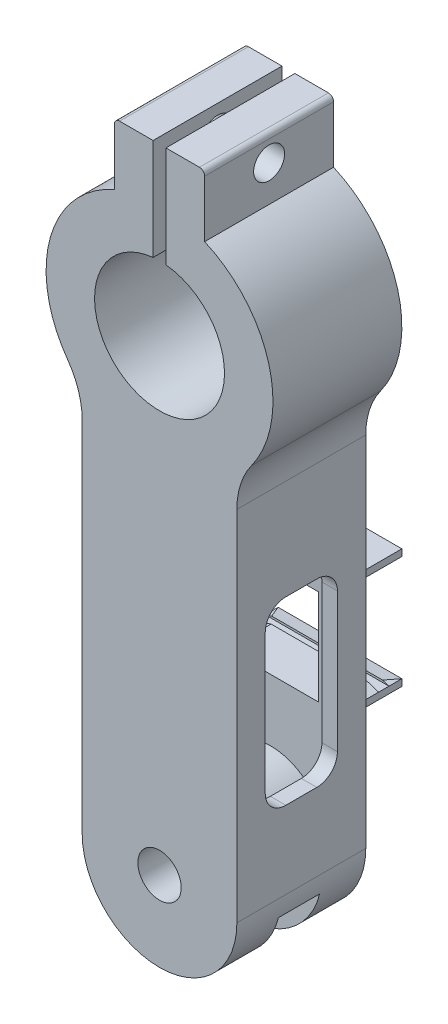
from build123d import *

# Parameters (mm, degrees)
BOSS_EXTRUDE1_DEPTH      = 25
CUT_EXTRUDE4_START       = 8.5
CUT_EXTRUDE4_DEPTH       = 8
SKETCH10_R               = 4.2
CUT_EXTRUDE6_DEPTH       = 122.590026426
SKETCH11_W               = 24
SKETCH11_H               = 24.52
BOSS_EXTRUDE2_DEPTH      = 10
CUT_EXTRUDE7_DEPTH       = 122.590026426
CUT_EXTRUDE8_START       = 5.5
SKETCH14_W               = 24
SKETCH14_H               = 20.52
CUT_EXTRUDE8_DEPTH       = 2
SKETCH22_R               = 12.6
CUT_EXTRUDE16_DEPTH      = 122.590026426
SKETCH24_W               = 17.5
SKETCH24_H               = 12
BOSS_EXTRUDE3_DEPTH      = 25
FILLET6_R                = 15
FILLET7_R                = 1
SKETCH25_R               = 3
CUT_EXTRUDE18_DEPTH      = 25
SKETCH26_W               = 2.5
SKETCH26_H               = 20
CUT_EXTRUDE19_DEPTH      = 25
SHELL14_START            = 9.25
SHELL14_DEPTH            = 1.5
SHELL14_START_2          = 3
SHELL14_2_DEPTH          = 19
SHELL14_3_OUTLINE_R      = 9.2
SHELL14_3_DEPTH          = 0.5
SHELL14_START_3          = 21.5
SHELL14_4_OUTLINE_R      = 9.2
SHELL14_4_DEPTH          = 0.5
SHELL14_START_4          = 8
SHELL14_5_DEPTH          = 2.75
SHELL14_START_5          = 19.25
SHELL14_6_DEPTH          = 1.5
SKETCH27_W               = 17.72
SKETCH27_H               = 18.5
CUT_EXTRUDE20_DEPTH      = 10
SKETCH28_W               = 14
SKETCH28_H               = 35
CUT_EXTRUDE21_DEPTH      = 3
SKETCH29_W               = 14
SKETCH29_H               = 35
CUT_EXTRUDE22_DEPTH      = 3
FILLET8_R                = 4
FILLET9_R                = 4
FILLET10_R               = 1
CUT_EXTRUDE23_DEPTH      = 132.116752851
CUT_EXTRUDE23_DEPTH_BACK = 132.116752851
SKETCH32_W               = 24
SKETCH32_H               = 0.7
CUT_EXTRUDE24_DEPTH      = 132.116752851
FILLET11_R               = 3
BOSS_EXTRUDE4_REACH      = 133.117
SKETCH33_W               = 28
SKETCH33_H               = 2


with BuildPart() as part:
    # Sketch1 → Boss-Extrude1 (new body)
    with BuildSketch(Plane.XY):
        with BuildLine():
            Line((30, 0), (30, 75))
            ThreePointArc((30, 75), (15, 113.093476939), (0, 75))
            Line((0, 75), (0, 0))
            ThreePointArc((0, 0), (15, -15), (30, 0))
        make_face()
    extrude(amount=BOSS_EXTRUDE1_DEPTH)

    # Sketch9 → Cut-Extrude4 (cut)
    with BuildSketch(Plane.XY.offset(CUT_EXTRUDE4_START)):
        with BuildLine():
            Line((7.015640289, 0), (0, -3.844579475))
            Line((0, -3.844579475), (0, -19.136394538))
            Line((0, -19.136394538), (30, -19.136394538))
            Line((30, -19.136394538), (30, -3.844579475))
            Line((30, -3.844579475), (22.984359711, 0))
            ThreePointArc((22.984359711, 0), (15, 8.5), (7.015640289, 0))
        make_face()
    extrude(amount=CUT_EXTRUDE4_DEPTH, mode=Mode.SUBTRACT)

    # Sketch10 → Cut-Extrude6 (cut, through all)
    with BuildSketch(Plane.XY):
        with Locations(Location((15, 0.5, 0), (0, 0, 180))):
            Circle(SKETCH10_R)
    extrude(amount=CUT_EXTRUDE6_DEPTH, mode=Mode.SUBTRACT)

    # Sketch11 → Boss-Extrude2 (add)
    with BuildSketch(Plane(origin=(0, 0, 0), x_dir=(-1, 0, 0), z_dir=(0, 0, -1))):
        with Locations((-15, 32.26)):
            Rectangle(SKETCH11_W, SKETCH11_H)
    extrude(amount=BOSS_EXTRUDE2_DEPTH)

    # Sketch12 → Cut-Extrude7 (cut, through all)
    with BuildSketch(Plane(origin=(0, 0, 0), x_dir=(-1, 0, 0), z_dir=(0, 0, -1))):
        Polygon((-3, 42.52), (-3, 22), (-6.14, 23), (-23.86, 23), (-27, 22), (-27, 42.52), (-23.86, 41.52), (-6.14, 41.52), align=None)
    extrude(amount=CUT_EXTRUDE7_DEPTH, mode=Mode.SUBTRACT)

    # Sketch14 → Cut-Extrude8 (cut)
    with BuildSketch(Plane(origin=(0, 0, 0), x_dir=(-1, 0, 0), z_dir=(0, 0, -1)).offset(CUT_EXTRUDE8_START)):
        with Locations((-15, 32.26)):
            Rectangle(SKETCH14_W, SKETCH14_H)
    extrude(amount=CUT_EXTRUDE8_DEPTH, mode=Mode.SUBTRACT)

    # Sketch22 → Cut-Extrude16 (cut, through all)
    with BuildSketch(Plane.XY):
        with Locations((15, 91.093476939)):
            Circle(SKETCH22_R)
    extrude(amount=CUT_EXTRUDE16_DEPTH, mode=Mode.SUBTRACT)

    # Sketch24 → Boss-Extrude3 (add)
    with BuildSketch(Plane.XY):
        with Locations((15, 117.278558064)):
            Rectangle(SKETCH24_W, SKETCH24_H)
    extrude(amount=BOSS_EXTRUDE3_DEPTH)

    # Fillet6
    fillet6_edges = [part.edges().sort_by_distance(p)[0] for p in [
        (0, 75, 12.5),
        (30, 75, 12.5),
    ]]
    fillet(fillet6_edges, radius=FILLET6_R)

    # Fillet7
    fillet7_edges = [part.edges().sort_by_distance(p)[0] for p in [
        (6.25, 123.278558064, 12.5),
        (23.75, 123.278558064, 12.5),
    ]]
    fillet(fillet7_edges, radius=FILLET7_R)

    # Sketch25 → Cut-Extrude18 (cut)
    with BuildSketch(Plane(origin=(23.75, 0, 23.75), x_dir=(0, 0, 1), z_dir=(-1, 0, 0))):
        with Locations(Location((-11.25, 118.278558064, 0), (0, 0, 180))):
            Circle(SKETCH25_R)
    extrude(amount=CUT_EXTRUDE18_DEPTH, mode=Mode.SUBTRACT)

    # Sketch26 → Cut-Extrude19 (cut)
    with BuildSketch(Plane(origin=(0, 0, 0), x_dir=(-1, 0, 0), z_dir=(0, 0, -1))):
        with Locations((-15, 113.278558064)):
            Rectangle(SKETCH26_W, SKETCH26_H)
    extrude(amount=-CUT_EXTRUDE19_DEPTH, mode=Mode.SUBTRACT)

    # Shell14: read off the stored shape, not the designer's step
    # Shell14 outline → Shell14 (cut)
    with BuildSketch(Plane.YZ.offset(SHELL14_START)):
        with BuildLine():
            Line((118.278558064, 22), (113.278558064, 22))
            Line((113.278558064, 22), (113.278558064, 15.81662479))
            ThreePointArc((113.278558064, 15.81662479), (115.441283733, 17.786764074), (118.278558064, 18.5))
            Line((118.278558064, 18.5), (118.278558064, 22))
        make_face()
        with BuildLine():
            ThreePointArc((118.278558064, 6.5), (115.441283733, 7.213235926), (113.278558064, 9.18337521))
            Line((113.278558064, 9.18337521), (113.278558064, 3))
            Line((113.278558064, 3), (118.278558064, 3))
            Line((118.278558064, 3), (118.278558064, 6.5))
        make_face()
    extrude(amount=SHELL14_DEPTH, mode=Mode.SUBTRACT)

    # Shell14 2 outline → Shell14 2 (cut)
    with BuildSketch(Plane.XY.offset(SHELL14_START_2)):
        with BuildLine():
            Line((20.75, 113.278558064), (19.25, 113.278558064))
            Line((19.25, 113.278558064), (19.25, 106.10339033))
            ThreePointArc((19.25, 106.10339033), (15, 75.493476939), (10.75, 106.10339033))
            Line((10.75, 106.10339033), (10.75, 113.278558064))
            Line((10.75, 113.278558064), (9.25, 113.278558064))
            Line((9.25, 113.278558064), (9.25, 109.202521641))
            ThreePointArc((9.25, 109.202521641), (-3.041191716, 97.052956906), (-0.405405405, 79.972618866))
            ThreePointArc((-0.405405405, 79.972618866), (2.127502776, 74.973191279), (3, 69.437069112))
            Line((3, 69.437069112), (3, 3.500970796))
            Line((3, 3.500970796), (4.734171365, 4.451298829))
            ThreePointArc((4.734171365, 4.451298829), (15, 11.5), (25.265828635, 4.451298829))
            Line((25.265828635, 4.451298829), (27, 3.500970796))
            Line((27, 3.500970796), (27, 69.437069112))
            ThreePointArc((27, 69.437069112), (27.872497224, 74.973191279), (30.405405405, 79.972618866))
            ThreePointArc((30.405405405, 79.972618866), (33.041191716, 97.052956906), (20.75, 109.202521641))
            Line((20.75, 109.202521641), (20.75, 113.278558064))
        make_face()
    extrude(amount=SHELL14_2_DEPTH, mode=Mode.SUBTRACT)

    # Shell14 3 outline → Shell14 3 (cut)
    with BuildSketch(Plane.XY.offset(SHELL14_START_2)):
        with BuildLine():
            Line((27, 0), (27, 3.500970796))
            Line((27, 3.500970796), (25.265828635, 4.451298829))
            ThreePointArc((25.265828635, 4.451298829), (15, 11.5), (4.734171365, 4.451298829))
            Line((4.734171365, 4.451298829), (3, 3.500970796))
            Line((3, 3.500970796), (3, 0))
            ThreePointArc((3, 0), (15, -12), (27, 0))
        make_face()
        with Locations((15, 0.5)):
            Circle(SHELL14_3_OUTLINE_R, mode=Mode.SUBTRACT)
    extrude(amount=SHELL14_3_DEPTH, mode=Mode.SUBTRACT)

    # Shell14 4 outline → Shell14 4 (cut)
    with BuildSketch(Plane.XY.offset(SHELL14_START_3)):
        with BuildLine():
            Line((27, 0), (27, 3.500970796))
            Line((27, 3.500970796), (25.265828635, 4.451298829))
            ThreePointArc((25.265828635, 4.451298829), (15, 11.5), (4.734171365, 4.451298829))
            Line((4.734171365, 4.451298829), (3, 3.500970796))
            Line((3, 3.500970796), (3, 0))
            ThreePointArc((3, 0), (15, -12), (27, 0))
        make_face()
        with Locations((15, 0.5)):
            Circle(SHELL14_4_OUTLINE_R, mode=Mode.SUBTRACT)
    extrude(amount=SHELL14_4_DEPTH, mode=Mode.SUBTRACT)

    # Shell14 5 outline → Shell14 5 (add)
    with BuildSketch(Plane.YZ.offset(SHELL14_START_4)):
        with BuildLine():
            Line((113.278558064, 9.18337521), (113.278558064, 15.81662479))
            ThreePointArc((113.278558064, 15.81662479), (112.278558064, 12.5), (113.278558064, 9.18337521))
        make_face()
    extrude(amount=SHELL14_5_DEPTH)

    # Shell14 6 outline → Shell14 6 (add)
    with BuildSketch(Plane.YZ.offset(SHELL14_START_5)):
        with BuildLine():
            Line((113.278558064, 9.18337521), (113.278558064, 15.81662479))
            ThreePointArc((113.278558064, 15.81662479), (112.278558064, 12.5), (113.278558064, 9.18337521))
        make_face()
    extrude(amount=SHELL14_6_DEPTH)

    # Sketch27 → Cut-Extrude20 (cut)
    with BuildSketch(Plane(origin=(0, 0, 0), x_dir=(-1, 0, 0), z_dir=(0, 0, -1))):
        with Locations((-15, 32.25)):
            Rectangle(SKETCH27_W, SKETCH27_H)
    extrude(amount=-CUT_EXTRUDE20_DEPTH, mode=Mode.SUBTRACT)

    # Sketch28 → Cut-Extrude21 (cut)
    with BuildSketch(Plane.ZY):
        with Locations((12.5, 32.5)):
            Rectangle(SKETCH28_W, SKETCH28_H)
    extrude(amount=-CUT_EXTRUDE21_DEPTH, mode=Mode.SUBTRACT)

    # Sketch29 → Cut-Extrude22 (cut)
    with BuildSketch(Plane(origin=(30, 0, -30), x_dir=(0, 0, 1), z_dir=(-1, 0, 0))):
        with Locations((42.5, 32.5)):
            Rectangle(SKETCH29_W, SKETCH29_H)
    extrude(amount=CUT_EXTRUDE22_DEPTH, mode=Mode.SUBTRACT)

    # Fillet8
    fillet8_edges = [part.edges().sort_by_distance(p)[0] for p in [
        (1.5, 15, 19.5),
        (1.5, 50, 19.5),
        (1.5, 50, 5.5),
        (1.5, 15, 5.5),
        (28.5, 50, 5.5),
        (28.5, 15, 5.5),
        (28.5, 15, 19.5),
        (28.5, 50, 19.5),
    ]]
    fillet(fillet8_edges, radius=FILLET8_R)

    # Fillet9
    # the kernel refuses this fillet: 4 mm, written as the material it adds along each edge
    with BuildSketch(Plane(origin=(3, 3.500970796, 3.5), x_dir=(0, 1, 0), z_dir=(0, 0, 1))) as fillet9_piece_1:
        with BuildLine():
            CenterArc((4.246692788, -4), FILLET9_R, 90, 55.496459683)
            Line((0.950328033, -1.734171365), (0.884400738, -1.688854792))
            ThreePointArc((0.884400738, -1.688854792), (0.405007614, -0.905531477), (-0.070156403, -0.038445795))
            Line((-0.070156403, -0.038445795), (0, 0.08))
            Line((0, 0.08), (4.246692788, 0.08))
            Line((4.246692788, 0.08), (4.246692788, 0))
        make_face()
    extrude(amount=18)
    with BuildSketch(Plane(origin=(27, 3.500970796, 3.5), x_dir=(0, 1, 0), z_dir=(0, 0, 1))) as fillet9_piece_2:
        with BuildLine():
            CenterArc((4.246692788, 4), FILLET9_R, 214.503540317, 55.496459683)
            Line((0.950328033, 1.734171365), (0.884400738, 1.688854792))
            ThreePointArc((0.884400738, 1.688854792), (0.405007614, 0.905531477), (-0.070156403, 0.038445795))
            Line((-0.070156403, 0.038445795), (0, -0.08))
            Line((0, -0.08), (4.246692788, -0.08))
            Line((4.246692788, -0.08), (4.246692788, 0))
        make_face()
    extrude(amount=18)

    # Fillet10
    fillet10_edges = [part.edges().sort_by_distance(p)[0] for p in [
        (25.265828635, 4.451298829, 12.5),
        (4.734171365, 4.451298829, 12.5),
    ]]
    fillet(fillet10_edges, radius=FILLET10_R)

    # Sketch30 → Cut-Extrude23 (cut, two sides: drawn at the far end of the back side and taken through both)
    with BuildSketch(Plane(origin=(0, 0, 0), x_dir=(0, 0, -1), z_dir=(1, 0, 0)).offset(-CUT_EXTRUDE23_DEPTH_BACK)):
        Polygon((10, 42.52), (10, 41.52), (7.5, 41.52), (7.5, 42.12), align=None)
        Polygon((10, 22), (10, 23), (7.5, 23), (7.5, 22.4), align=None)
    extrude(amount=CUT_EXTRUDE23_DEPTH + CUT_EXTRUDE23_DEPTH_BACK, mode=Mode.SUBTRACT)

    # Sketch32 → Cut-Extrude24 (cut, through all)
    with BuildSketch(Plane(origin=(0, 0, 0), x_dir=(-1, 0, 0), z_dir=(0, 0, -1))):
        with Locations((-15, 44.17)):
            Rectangle(SKETCH32_W, SKETCH32_H)
        with Locations((-15, 20.35)):
            Rectangle(SKETCH32_W, SKETCH32_H)
    extrude(amount=CUT_EXTRUDE24_DEPTH, mode=Mode.SUBTRACT)

    # Fillet11
    fillet11_edges = [part.edges().sort_by_distance(p)[0] for p in [
        (15, 43.82, 0),
        (15, 20.7, 0),
    ]]
    fillet(fillet11_edges, radius=FILLET11_R)

    # Sketch33 → Boss-Extrude4 (add, up to next)
    with BuildSketch(Plane(origin=(0, 0, 0), x_dir=(-1, 0, 0), z_dir=(0, 0, -1)), mode=Mode.PRIVATE) as boss_extrude4_sk1:
        with Locations((-15, 71)):
            Rectangle(SKETCH33_W, SKETCH33_H)
    boss_extrude4_tool1 = extrude(boss_extrude4_sk1.sketch, amount=-BOSS_EXTRUDE4_REACH, mode=Mode.PRIVATE) - part.part
    add(boss_extrude4_tool1.solids().sort_by_distance((15, 71, 0))[0])


solid = part.part
